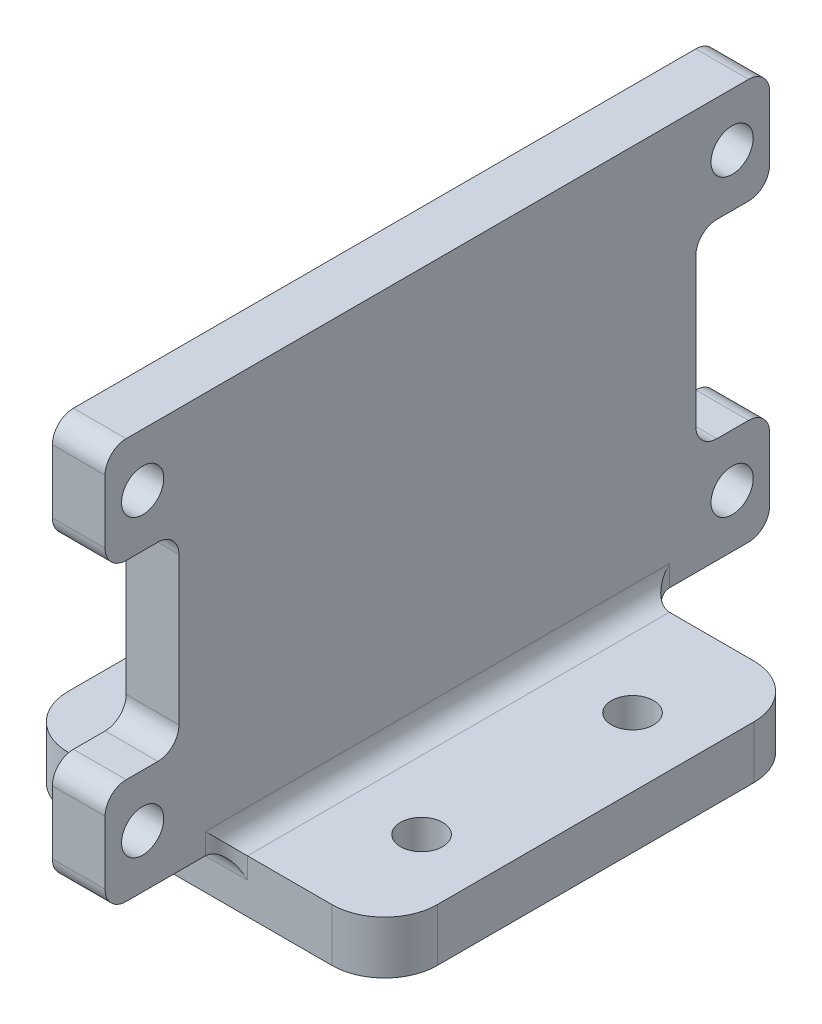
from build123d import *

# Parameters (mm, degrees)
ESQUISSE2_W             = 35
ESQUISSE2_H             = 40
BOSS_EXTRU_1_DEPTH      = 5
ESQUISSE3_W             = 63
ESQUISSE3_H             = 38
BOSS_EXTRU_2_DEPTH      = 2.5
ENL_V_MAT_EXTRU_1_REACH = 58.932
ESQUISSE4_R             = 2
ENL_V_MAT_EXTRU_2_REACH = 58.932
ESQUISSE5_W             = 7
ESQUISSE5_H             = 18
CONG_1_R                = 2
CONG_2_R                = 5
CONG_3_R                = 2
ENL_V_MAT_EXTRU_3_REACH = 54.369
ESQUISSE6_R             = 2


with BuildPart() as part:
    # Esquisse2 → Boss.-Extru.1 (new body)
    with BuildSketch(Plane(origin=(0, 0, 0), x_dir=(1, 0, 0), z_dir=(0, 1, 0))):
        Rectangle(ESQUISSE2_W, ESQUISSE2_H)
    extrude(amount=BOSS_EXTRU_1_DEPTH)

    # Esquisse3 → Boss.-Extru.2 (add, symmetric)
    with BuildSketch(Plane(origin=(0, 0, 0), x_dir=(0, 0, -1), z_dir=(1, 0, 0))):
        with Locations((0, 24)):
            Rectangle(ESQUISSE3_W, ESQUISSE3_H)
    extrude(amount=BOSS_EXTRU_2_DEPTH, both=True)

    # Esquisse4 → Enlèv. mat.-Extru.1 (cut, up to next)
    with BuildSketch(Plane(origin=(2.5, 0, 0), x_dir=(0, 0, -1), z_dir=(1, 0, 0)), mode=Mode.PRIVATE) as enl_v_mat_extru_1_sk1:
        with Locations((-27.94, 37.97)):
            Circle(ESQUISSE4_R)
    enl_v_mat_extru_1_tool1 = extrude(enl_v_mat_extru_1_sk1.sketch, amount=-ENL_V_MAT_EXTRU_1_REACH, mode=Mode.PRIVATE) & part.part
    # Esquisse4 → Enlèv. mat.-Extru.1 (cut, up to next)
    with BuildSketch(Plane(origin=(2.5, 0, 0), x_dir=(0, 0, -1), z_dir=(1, 0, 0)), mode=Mode.PRIVATE) as enl_v_mat_extru_1_sk2:
        with Locations((-27.94, 10.03)):
            Circle(ESQUISSE4_R)
    enl_v_mat_extru_1_tool2 = extrude(enl_v_mat_extru_1_sk2.sketch, amount=-ENL_V_MAT_EXTRU_1_REACH, mode=Mode.PRIVATE) & part.part
    # Esquisse4 → Enlèv. mat.-Extru.1 (cut, up to next)
    with BuildSketch(Plane(origin=(2.5, 0, 0), x_dir=(0, 0, -1), z_dir=(1, 0, 0)), mode=Mode.PRIVATE) as enl_v_mat_extru_1_sk3:
        with Locations((27.94, 37.97)):
            Circle(ESQUISSE4_R)
    enl_v_mat_extru_1_tool3 = extrude(enl_v_mat_extru_1_sk3.sketch, amount=-ENL_V_MAT_EXTRU_1_REACH, mode=Mode.PRIVATE) & part.part
    # Esquisse4 → Enlèv. mat.-Extru.1 (cut, up to next)
    with BuildSketch(Plane(origin=(2.5, 0, 0), x_dir=(0, 0, -1), z_dir=(1, 0, 0)), mode=Mode.PRIVATE) as enl_v_mat_extru_1_sk4:
        with Locations((27.94, 10.03)):
            Circle(ESQUISSE4_R)
    enl_v_mat_extru_1_tool4 = extrude(enl_v_mat_extru_1_sk4.sketch, amount=-ENL_V_MAT_EXTRU_1_REACH, mode=Mode.PRIVATE) & part.part
    add(enl_v_mat_extru_1_tool1.solids().sort_by_distance((2.5, 37.97, 27.94))[0], mode=Mode.SUBTRACT)
    add(enl_v_mat_extru_1_tool2.solids().sort_by_distance((2.5, 10.03, 27.94))[0], mode=Mode.SUBTRACT)
    add(enl_v_mat_extru_1_tool3.solids().sort_by_distance((2.5, 37.97, -27.94))[0], mode=Mode.SUBTRACT)
    add(enl_v_mat_extru_1_tool4.solids().sort_by_distance((2.5, 10.03, -27.94))[0], mode=Mode.SUBTRACT)

    # Esquisse5 → Enlèv. mat.-Extru.2 (cut, up to next)
    with BuildSketch(Plane(origin=(2.5, 0, 0), x_dir=(0, 0, -1), z_dir=(1, 0, 0)), mode=Mode.PRIVATE) as enl_v_mat_extru_2_sk1:
        with Locations((-28, 24)):
            Rectangle(ESQUISSE5_W, ESQUISSE5_H)
    enl_v_mat_extru_2_tool1 = extrude(enl_v_mat_extru_2_sk1.sketch, amount=-ENL_V_MAT_EXTRU_2_REACH, mode=Mode.PRIVATE) & part.part
    # Esquisse5 → Enlèv. mat.-Extru.2 (cut, up to next)
    with BuildSketch(Plane(origin=(2.5, 0, 0), x_dir=(0, 0, -1), z_dir=(1, 0, 0)), mode=Mode.PRIVATE) as enl_v_mat_extru_2_sk2:
        with Locations((28, 24)):
            Rectangle(ESQUISSE5_W, ESQUISSE5_H)
    enl_v_mat_extru_2_tool2 = extrude(enl_v_mat_extru_2_sk2.sketch, amount=-ENL_V_MAT_EXTRU_2_REACH, mode=Mode.PRIVATE) & part.part
    add(enl_v_mat_extru_2_tool1.solids().sort_by_distance((2.5, 24, 28))[0], mode=Mode.SUBTRACT)
    add(enl_v_mat_extru_2_tool2.solids().sort_by_distance((2.5, 24, -28))[0], mode=Mode.SUBTRACT)

    # Congé1
    cong_1_edges = [part.edges().sort_by_distance(p)[0] for p in [
        (0, 15, -24.5),
        (0, 33, -24.5),
        (0, 15, 24.5),
        (0, 33, 24.5),
        (-2.5, 5, 0),
        (2.5, 5, 0),
    ]]
    fillet(cong_1_edges, radius=CONG_1_R)
    cong_1_2_edges = [part.edges().sort_by_distance(p)[0] for p in [
        (0, 5, -31.5),
        (0, 15, -31.5),
        (0, 43, -31.5),
        (0, 33, -31.5),
        (0, 5, 31.5),
        (0, 15, 31.5),
        (0, 33, 31.5),
        (0, 43, 31.5),
    ]]
    fillet(cong_1_2_edges, radius=CONG_1_R)

    # Congé2
    cong_2_edges = [part.edges().sort_by_distance(p)[0] for p in [
        (17.5, 2.5, 20),
        (-17.5, 2.5, 20),
        (-17.5, 2.5, -20),
        (17.5, 2.5, -20),
    ]]
    fillet(cong_2_edges, radius=CONG_2_R)

    # Congé3
    cong_3_edges = [part.edges().sort_by_distance(p)[0] for p in [
        (-2.5, 6, 20),
        (2.5, 6, 20),
        (0, 5, 20),
        (2.5, 6, -20),
        (-2.5, 6, -20),
        (0, 5, -20),
    ]]
    fillet(cong_3_edges, radius=CONG_3_R - 0.0001)  # a hair under: the kernel refuses the full size

    # Esquisse6 → Enlèv. mat.-Extru.3 (cut, up to next)
    with BuildSketch(Plane(origin=(0, 5, 0), x_dir=(1, 0, 0), z_dir=(0, 1, 0)), mode=Mode.PRIVATE) as enl_v_mat_extru_3_sk1:
        with Locations(Location((-11, 10, 0), (0, 0, 270))):
            Circle(ESQUISSE6_R)
    enl_v_mat_extru_3_tool1 = extrude(enl_v_mat_extru_3_sk1.sketch, amount=-ENL_V_MAT_EXTRU_3_REACH, mode=Mode.PRIVATE) & part.part
    # Esquisse6 → Enlèv. mat.-Extru.3 (cut, up to next)
    with BuildSketch(Plane(origin=(0, 5, 0), x_dir=(1, 0, 0), z_dir=(0, 1, 0)), mode=Mode.PRIVATE) as enl_v_mat_extru_3_sk2:
        with Locations(Location((-11, -10, 0), (0, 0, 270))):
            Circle(ESQUISSE6_R)
    enl_v_mat_extru_3_tool2 = extrude(enl_v_mat_extru_3_sk2.sketch, amount=-ENL_V_MAT_EXTRU_3_REACH, mode=Mode.PRIVATE) & part.part
    # Esquisse6 → Enlèv. mat.-Extru.3 (cut, up to next)
    with BuildSketch(Plane(origin=(0, 5, 0), x_dir=(1, 0, 0), z_dir=(0, 1, 0)), mode=Mode.PRIVATE) as enl_v_mat_extru_3_sk3:
        with Locations(Location((11, -10, 0), (0, 0, 90))):
            Circle(ESQUISSE6_R)
    enl_v_mat_extru_3_tool3 = extrude(enl_v_mat_extru_3_sk3.sketch, amount=-ENL_V_MAT_EXTRU_3_REACH, mode=Mode.PRIVATE) & part.part
    # Esquisse6 → Enlèv. mat.-Extru.3 (cut, up to next)
    with BuildSketch(Plane(origin=(0, 5, 0), x_dir=(1, 0, 0), z_dir=(0, 1, 0)), mode=Mode.PRIVATE) as enl_v_mat_extru_3_sk4:
        with Locations(Location((11, 10, 0), (0, 0, 90))):
            Circle(ESQUISSE6_R)
    enl_v_mat_extru_3_tool4 = extrude(enl_v_mat_extru_3_sk4.sketch, amount=-ENL_V_MAT_EXTRU_3_REACH, mode=Mode.PRIVATE) & part.part
    add(enl_v_mat_extru_3_tool1.solids().sort_by_distance((-11, 5, -10))[0], mode=Mode.SUBTRACT)
    add(enl_v_mat_extru_3_tool2.solids().sort_by_distance((-11, 5, 10))[0], mode=Mode.SUBTRACT)
    add(enl_v_mat_extru_3_tool3.solids().sort_by_distance((11, 5, 10))[0], mode=Mode.SUBTRACT)
    add(enl_v_mat_extru_3_tool4.solids().sort_by_distance((11, 5, -10))[0], mode=Mode.SUBTRACT)


solid = part.part
